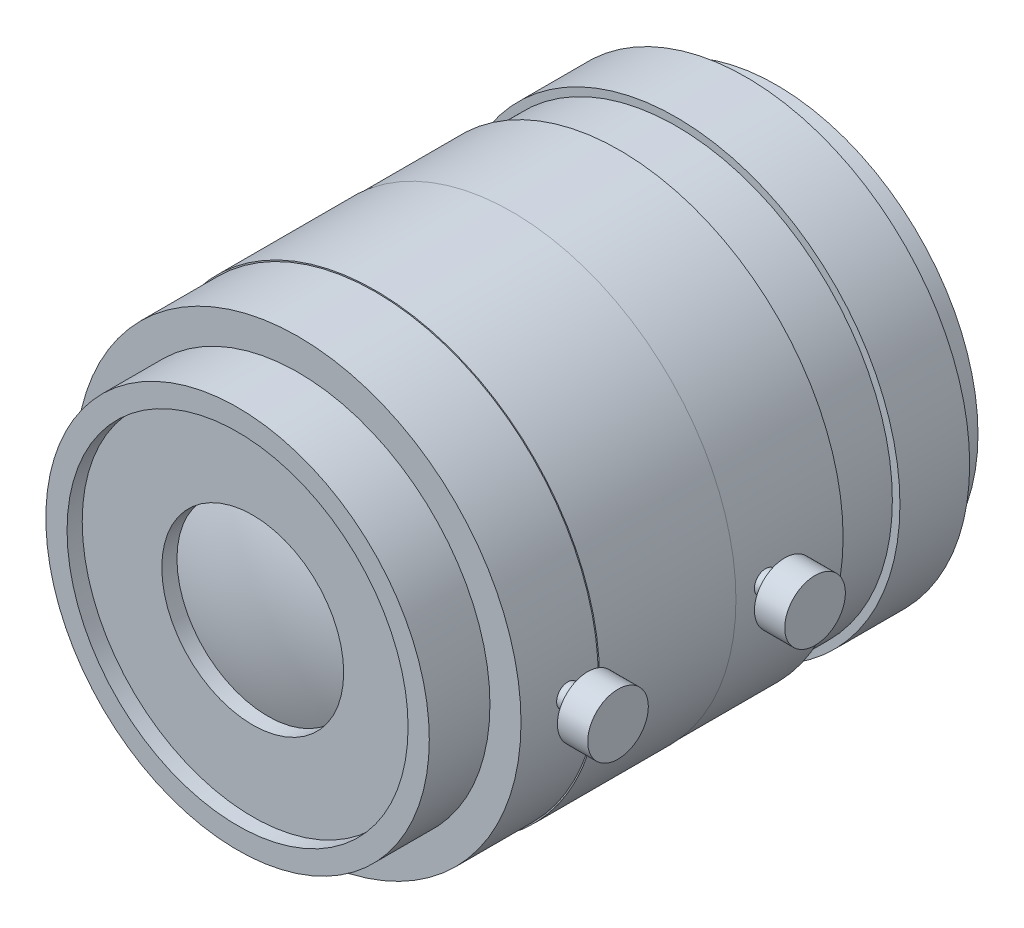
from build123d import *

# Parameters (mm, degrees)
SKETCH1_R       = 13.3
SKETCH1_R_2     = 12.5
EXTRUDE1_DEPTH  = 2
SKETCH2_R       = 14.75
SKETCH2_R_2     = 12.5
EXTRUDE2_DEPTH  = 4.6
SKETCH3_R       = 14.25
EXTRUDE3_DEPTH  = 3.75
SKETCH4_R       = 14.75
EXTRUDE4_DEPTH  = 7.1
SKETCH5_R       = 14.78
EXTRUDE5_DEPTH  = 9
SKETCH6_R       = 14.7
EXTRUDE6_DEPTH  = 5.1
SKETCH7_R       = 12.65
EXTRUDE7_DEPTH  = 4
SKETCH8_R       = 11.25
EXTRUDE8_DEPTH  = 1
SKETCH9_R       = 8.875
EXTRUDE9_DEPTH  = 1
SKETCH10_R      = 6
EXTRUDE10_DEPTH = 1
SKETCH11_R      = 0.75
EXTRUDE11_DEPTH = 16
SKETCH12_R      = 2
EXTRUDE12_DEPTH = 2


# Read off the part's stored shape, not the designer's step: Dome1, Dome2
with BuildPart() as part:
    # Sketch1 → Extrude1 (new body)
    with BuildSketch(Plane.XY):
        Circle(SKETCH1_R)
        Circle(SKETCH1_R_2, mode=Mode.SUBTRACT)
    extrude(amount=EXTRUDE1_DEPTH)

    # Sketch2 → Extrude2 (add)
    with BuildSketch(Plane.XY.offset(2)):
        Circle(SKETCH2_R)
        Circle(SKETCH2_R_2, mode=Mode.SUBTRACT)
    extrude(amount=EXTRUDE2_DEPTH)

    # Sketch3 → Extrude3 (add)
    with BuildSketch(Plane.XY.offset(6.6)):
        Circle(SKETCH3_R)
    extrude(amount=EXTRUDE3_DEPTH)

    # Sketch4 → Extrude4 (add)
    with BuildSketch(Plane.XY.offset(10.35)):
        Circle(SKETCH4_R)
    extrude(amount=EXTRUDE4_DEPTH)

    # Sketch5 → Extrude5 (add)
    with BuildSketch(Plane.XY.offset(17.45)):
        Circle(SKETCH5_R)
    extrude(amount=EXTRUDE5_DEPTH)

    # Sketch6 → Extrude6 (add)
    with BuildSketch(Plane.XY.offset(26.45)):
        Circle(SKETCH6_R)
    extrude(amount=EXTRUDE6_DEPTH)

    # Sketch7 → Extrude7 (add)
    with BuildSketch(Plane.XY.offset(31.55)):
        Circle(SKETCH7_R)
    extrude(amount=EXTRUDE7_DEPTH)

    # Sketch8 → Extrude8 (cut)
    with BuildSketch(Plane.XY.offset(35.55)):
        Circle(SKETCH8_R)
    extrude(amount=-EXTRUDE8_DEPTH, mode=Mode.SUBTRACT)

    # Sketch9 → Extrude9 (cut)
    with BuildSketch(Plane(origin=(0, 0, 6.6), x_dir=(-1, 0, 0), z_dir=(0, 0, -1))):
        Circle(SKETCH9_R)
    extrude(amount=-EXTRUDE9_DEPTH, mode=Mode.SUBTRACT)

    # Dome1 outline → Dome1 (revolve)
    with BuildSketch(Plane.XZ):
        with BuildLine():
            Line((0, 7.600000009), (0, 4.6))
            ThreePointArc((0, 4.6), (4.684165488, 5.370281289), (8.875000012, 7.600000009))
            Line((8.875000012, 7.600000009), (0, 7.600000009))
        make_face()
    revolve(axis=Axis((0, 0, 0), (0, 0, 1)))

    # Sketch10 → Extrude10 (cut)
    with BuildSketch(Plane.XY.offset(34.55)):
        Circle(SKETCH10_R)
    extrude(amount=-EXTRUDE10_DEPTH, mode=Mode.SUBTRACT)

    # Dome2 outline → Dome2 (revolve)
    with BuildSketch(Plane.XZ):
        with BuildLine():
            Line((0, 33.55), (6.000000017, 33.549999994))
            ThreePointArc((6.000000017, 33.549999994), (3.041381274, 34.298287589), (0, 34.55))
            Line((0, 34.55), (0, 33.55))
        make_face()
    revolve(axis=Axis((0, 0, 0), (0, 0, 1)))

    # Sketch11 → Extrude11 (add)
    with BuildSketch(Plane(origin=(0, 0, 0), x_dir=(0, 0, -1), z_dir=(1, 0, 0))):
        with Locations((-28.45, 0)):
            Circle(SKETCH11_R)
        with Locations((-15.45, 0)):
            Circle(SKETCH11_R)
    extrude(amount=EXTRUDE11_DEPTH)

    # Sketch12 → Extrude12 (add)
    with BuildSketch(Plane(origin=(16, 0, 0), x_dir=(0, 0, -1), z_dir=(1, 0, 0))):
        with Locations((-28.45, 0)):
            Circle(SKETCH12_R)
        with Locations((-15.45, 0)):
            Circle(SKETCH12_R)
    extrude(amount=EXTRUDE12_DEPTH)


solid = part.part
